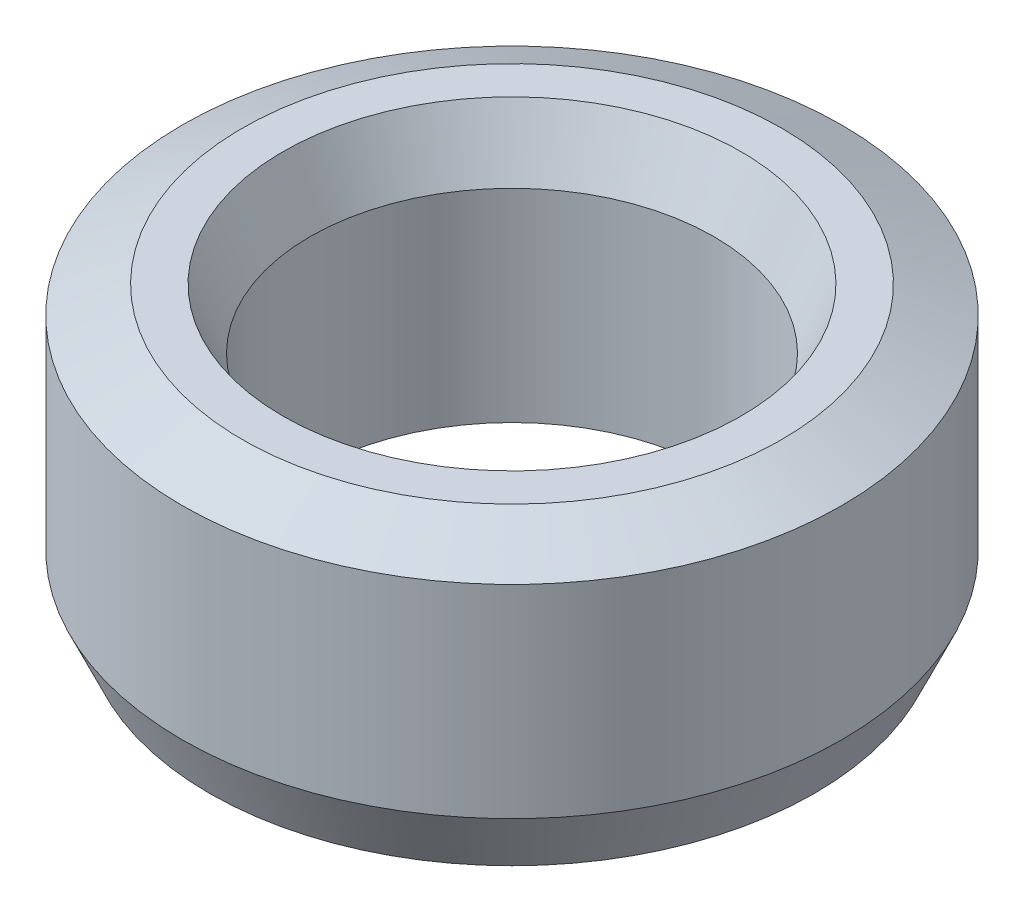
from build123d import *
from OCP.BRepFilletAPI import BRepFilletAPI_MakeChamfer

# Parameters (mm, degrees)
SKETCH1_R           = 37.5
BOSS_EXTRUDE1_DEPTH = 32.98672873
SKETCH2_R           = 22.963317988
CUT_EXTRUDE1_DEPTH  = 63.454977963
CHAMFER1_SIZE       = 3.09244607
CHAMFER1_SIZE2      = 6.82147117


with BuildPart() as part:
    # Sketch1 → Boss-Extrude1 (new body)
    with BuildSketch(Plane(origin=(0, 0, 0), x_dir=(1, 0, 0), z_dir=(0, 1, 0))):
        Circle(SKETCH1_R)
    extrude(amount=BOSS_EXTRUDE1_DEPTH)

    # Sketch2 → Cut-Extrude1 (cut, through all)
    with BuildSketch(Plane(origin=(0, 0, 0), x_dir=(1, 0, 0), z_dir=(0, 1, 0))):
        Circle(SKETCH2_R)
    extrude(amount=CUT_EXTRUDE1_DEPTH, mode=Mode.SUBTRACT)

    # Chamfer1: one chamfer whose edges measure the first distance from different faces: ONE call of the kernel's chamfer builder (chamfer() names one face for all edges)
    chamfer1_edges_1 = [part.edges().sort_by_distance(p)[0] for p in [
        (-22.963317988, 32.98672873, 0),
    ]]
    chamfer1_side_1 = [part.faces().sort_by_distance(p)[0] for p in [
        (-36.439339828, 32.98672873, 0),
    ]]
    chamfer1_edges_2 = [part.edges().sort_by_distance(p)[0] for p in [
        (-22.963317988, 0, 0),
    ]]
    chamfer1_side_2 = [part.faces().sort_by_distance(p)[0] for p in [
        (-22.963317988, 16.493364365, 0),
    ]]
    chamfer1_edges_3 = [part.edges().sort_by_distance(p)[0] for p in [
        (-37.5, 0, 0),
    ]]
    chamfer1_side_3 = [part.faces().sort_by_distance(p)[0] for p in [
        (-36.439339828, 0, 0),
    ]]
    chamfer1_edges_4 = [part.edges().sort_by_distance(p)[0] for p in [
        (-37.5, 32.98672873, 0),
    ]]
    chamfer1_side_4 = [part.faces().sort_by_distance(p)[0] for p in [
        (-37.5, 16.493364365, 0),
    ]]
    chamfer1 = BRepFilletAPI_MakeChamfer(part.part.solid().wrapped)
    for e in chamfer1_edges_1:
        chamfer1.Add(CHAMFER1_SIZE, CHAMFER1_SIZE2, e.wrapped, chamfer1_side_1[0].wrapped)  # the first distance lies on this face
    for e in chamfer1_edges_2:
        chamfer1.Add(CHAMFER1_SIZE, CHAMFER1_SIZE2, e.wrapped, chamfer1_side_2[0].wrapped)  # the first distance lies on this face
    for e in chamfer1_edges_3:
        chamfer1.Add(CHAMFER1_SIZE, CHAMFER1_SIZE2, e.wrapped, chamfer1_side_3[0].wrapped)  # the first distance lies on this face
    for e in chamfer1_edges_4:
        chamfer1.Add(CHAMFER1_SIZE, CHAMFER1_SIZE2, e.wrapped, chamfer1_side_4[0].wrapped)  # the first distance lies on this face
    add(Compound.cast(chamfer1.Shape()), mode=Mode.REPLACE)


solid = part.part
